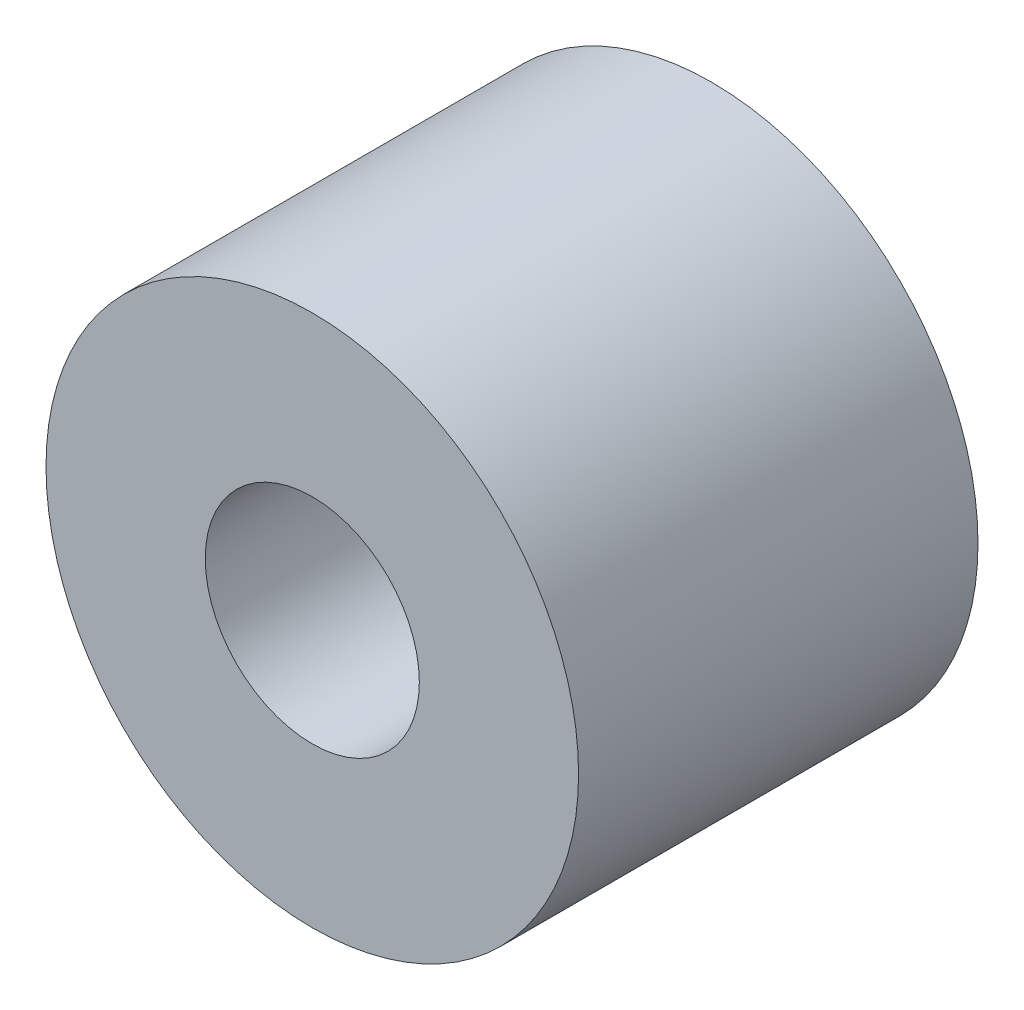
from build123d import *

# Parameters (mm, degrees)
SKETCH1_R                   = 6.35
BOSS_EXTRUDE1_DEPTH         = 4.7625
TAP_DRILL_FOR_1_4_20_TAP1_D = 5.1054


with BuildPart() as part:
    # Sketch1 → Boss-Extrude1 (new, symmetric)
    with BuildSketch(Plane.XY):
        Circle(SKETCH1_R)
    extrude(amount=BOSS_EXTRUDE1_DEPTH, both=True)

    # Tap Drill for 1/4-20 Tap1 (through all)
    with Locations(Plane.XY.offset(4.7625)):
        with Locations((0, 0)):
            Hole(TAP_DRILL_FOR_1_4_20_TAP1_D / 2)


solid = part.part
